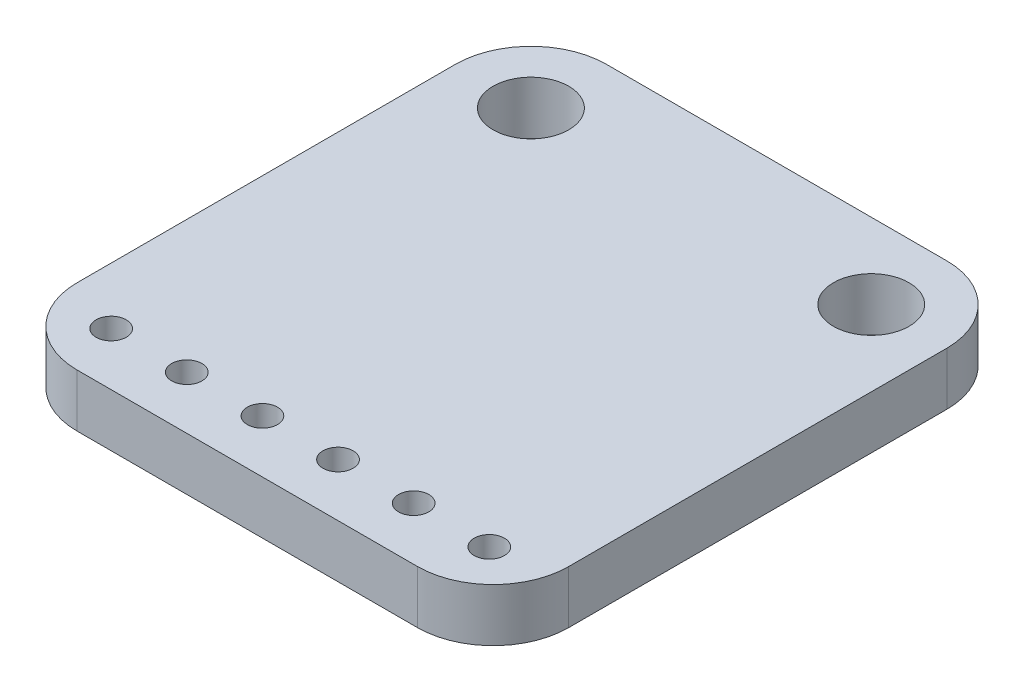
from build123d import *

# Parameters (mm, degrees)
SKETCH1_W           = 16.51
SKETCH1_H           = 17.78
BOSS_EXTRUDE1_DEPTH = 1.778
FILLET1_R           = 2.54
CUT_EXTRUDE1_REACH  = 14.261
SKETCH2_R           = 0.508
SKETCH4_W           = 3.95
SKETCH4_H           = 3.95
BOSS_EXTRUDE3_DEPTH = 1.397
CUT_EXTRUDE2_REACH  = 14.261
SKETCH5_R           = 1.27


with BuildPart() as part:
    # Sketch1 → Boss-Extrude1 (new body)
    with BuildSketch(Plane(origin=(0, 0, 0), x_dir=(1, 0, 0), z_dir=(0, 1, 0))):
        Rectangle(SKETCH1_W, SKETCH1_H)
    extrude(amount=BOSS_EXTRUDE1_DEPTH)

    # Fillet1
    fillet1_edges = [part.edges().sort_by_distance(p)[0] for p in [
        (-8.255, 0.889, 8.89),
        (-8.255, 0.889, -8.89),
        (8.255, 0.889, -8.89),
        (8.255, 0.889, 8.89),
    ]]
    fillet(fillet1_edges, radius=FILLET1_R)

    # Sketch2 → Cut-Extrude1 (cut, up to next)
    with BuildSketch(Plane(origin=(0, 1.778, 0), x_dir=(1, 0, 0), z_dir=(0, 1, 0)), mode=Mode.PRIVATE) as cut_extrude1_sk1:
        with Locations((-6.35, -7.112)):
            Circle(SKETCH2_R)
    cut_extrude1_tool1 = extrude(cut_extrude1_sk1.sketch, amount=-CUT_EXTRUDE1_REACH, mode=Mode.PRIVATE) & part.part
    # Sketch2 → Cut-Extrude1 (cut, up to next)
    with BuildSketch(Plane(origin=(0, 1.778, 0), x_dir=(1, 0, 0), z_dir=(0, 1, 0)), mode=Mode.PRIVATE) as cut_extrude1_sk2:
        with Locations((-3.81, -7.112)):
            Circle(SKETCH2_R)
    cut_extrude1_tool2 = extrude(cut_extrude1_sk2.sketch, amount=-CUT_EXTRUDE1_REACH, mode=Mode.PRIVATE) & part.part
    # Sketch2 → Cut-Extrude1 (cut, up to next)
    with BuildSketch(Plane(origin=(0, 1.778, 0), x_dir=(1, 0, 0), z_dir=(0, 1, 0)), mode=Mode.PRIVATE) as cut_extrude1_sk3:
        with Locations((-1.27, -7.112)):
            Circle(SKETCH2_R)
    cut_extrude1_tool3 = extrude(cut_extrude1_sk3.sketch, amount=-CUT_EXTRUDE1_REACH, mode=Mode.PRIVATE) & part.part
    # Sketch2 → Cut-Extrude1 (cut, up to next)
    with BuildSketch(Plane(origin=(0, 1.778, 0), x_dir=(1, 0, 0), z_dir=(0, 1, 0)), mode=Mode.PRIVATE) as cut_extrude1_sk4:
        with Locations((1.27, -7.112)):
            Circle(SKETCH2_R)
    cut_extrude1_tool4 = extrude(cut_extrude1_sk4.sketch, amount=-CUT_EXTRUDE1_REACH, mode=Mode.PRIVATE) & part.part
    # Sketch2 → Cut-Extrude1 (cut, up to next)
    with BuildSketch(Plane(origin=(0, 1.778, 0), x_dir=(1, 0, 0), z_dir=(0, 1, 0)), mode=Mode.PRIVATE) as cut_extrude1_sk5:
        with Locations((3.81, -7.112)):
            Circle(SKETCH2_R)
    cut_extrude1_tool5 = extrude(cut_extrude1_sk5.sketch, amount=-CUT_EXTRUDE1_REACH, mode=Mode.PRIVATE) & part.part
    # Sketch2 → Cut-Extrude1 (cut, up to next)
    with BuildSketch(Plane(origin=(0, 1.778, 0), x_dir=(1, 0, 0), z_dir=(0, 1, 0)), mode=Mode.PRIVATE) as cut_extrude1_sk6:
        with Locations((6.35, -7.112)):
            Circle(SKETCH2_R)
    cut_extrude1_tool6 = extrude(cut_extrude1_sk6.sketch, amount=-CUT_EXTRUDE1_REACH, mode=Mode.PRIVATE) & part.part
    add(cut_extrude1_tool1.solids().sort_by_distance((-6.35, 1.778, 7.112))[0], mode=Mode.SUBTRACT)
    add(cut_extrude1_tool2.solids().sort_by_distance((-3.81, 1.778, 7.112))[0], mode=Mode.SUBTRACT)
    add(cut_extrude1_tool3.solids().sort_by_distance((-1.27, 1.778, 7.112))[0], mode=Mode.SUBTRACT)
    add(cut_extrude1_tool4.solids().sort_by_distance((1.27, 1.778, 7.112))[0], mode=Mode.SUBTRACT)
    add(cut_extrude1_tool5.solids().sort_by_distance((3.81, 1.778, 7.112))[0], mode=Mode.SUBTRACT)
    add(cut_extrude1_tool6.solids().sort_by_distance((6.35, 1.778, 7.112))[0], mode=Mode.SUBTRACT)

    # Sketch4 → Boss-Extrude3 (add)
    with BuildSketch(Plane(origin=(0, 0, 0), x_dir=(-1, 0, 0), z_dir=(0, -1, 0))):
        with Locations((0, 1.27)):
            Rectangle(SKETCH4_W, SKETCH4_H)
    extrude(amount=BOSS_EXTRUDE3_DEPTH)

    # Sketch5 → Cut-Extrude2 (cut, up to next)
    with BuildSketch(Plane(origin=(0, 0, 0), x_dir=(-1, 0, 0), z_dir=(0, -1, 0)), mode=Mode.PRIVATE) as cut_extrude2_sk1:
        with Locations((-5.715, 6.35)):
            Circle(SKETCH5_R)
    cut_extrude2_tool1 = extrude(cut_extrude2_sk1.sketch, amount=-CUT_EXTRUDE2_REACH, mode=Mode.PRIVATE) & part.part
    # Sketch5 → Cut-Extrude2 (cut, up to next)
    with BuildSketch(Plane(origin=(0, 0, 0), x_dir=(-1, 0, 0), z_dir=(0, -1, 0)), mode=Mode.PRIVATE) as cut_extrude2_sk2:
        with Locations((5.715, 6.35)):
            Circle(SKETCH5_R)
    cut_extrude2_tool2 = extrude(cut_extrude2_sk2.sketch, amount=-CUT_EXTRUDE2_REACH, mode=Mode.PRIVATE) & part.part
    add(cut_extrude2_tool1.solids().sort_by_distance((5.715, 0, -6.35))[0], mode=Mode.SUBTRACT)
    add(cut_extrude2_tool2.solids().sort_by_distance((-5.715, 0, -6.35))[0], mode=Mode.SUBTRACT)


solid = part.part
